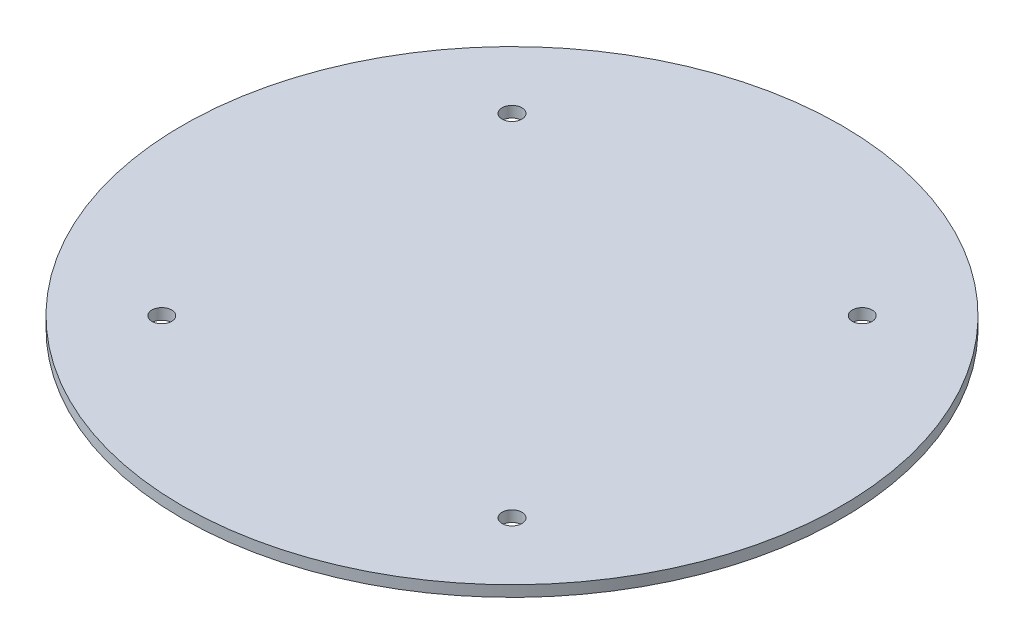
from build123d import *

# Parameters (mm, degrees)
SKETCH1_R           = 76.2
SKETCH1_R_2         = 2.286
BOSS_EXTRUDE2_DEPTH = 2.54


with BuildPart() as part:
    # Sketch1 → Boss-Extrude2 (new body)
    with BuildSketch(Plane(origin=(0, 0, 0), x_dir=(1, 0, 0), z_dir=(0, 1, 0))):
        Circle(SKETCH1_R)
        with Locations((40.49, 40.49)):
            Circle(SKETCH1_R_2, mode=Mode.SUBTRACT)
        with Locations((40.49, -40.49)):
            Circle(SKETCH1_R_2, mode=Mode.SUBTRACT)
        with Locations((-40.49, -40.49)):
            Circle(SKETCH1_R_2, mode=Mode.SUBTRACT)
        with Locations((-40.49, 40.49)):
            Circle(SKETCH1_R_2, mode=Mode.SUBTRACT)
    extrude(amount=BOSS_EXTRUDE2_DEPTH)


solid = part.part
